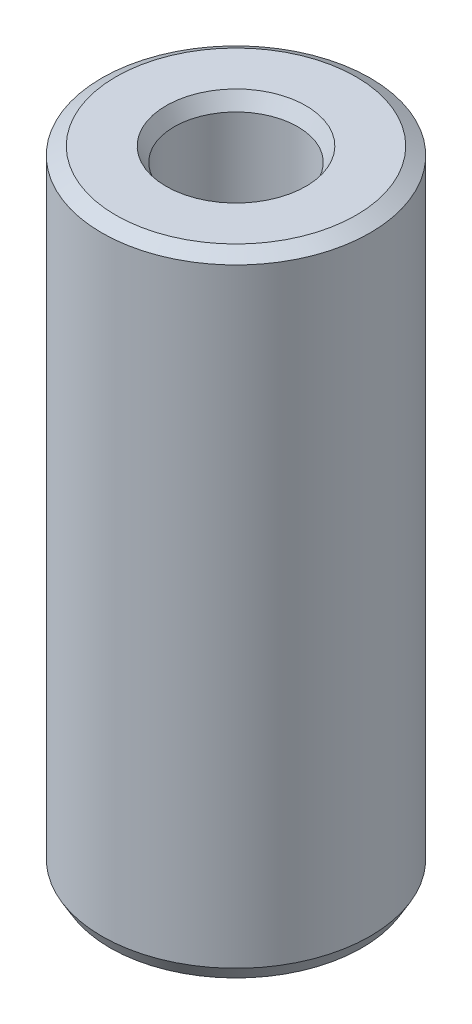
from build123d import *
from OCP.BRepFilletAPI import BRepFilletAPI_MakeChamfer

# Parameters (mm, degrees)
SKETCH1_R           = 40
BOSS_EXTRUDE1_DEPTH = 188.235904036
SKETCH2_R           = 18.406566758
CUT_EXTRUDE1_DEPTH  = 197.552170093
CHAMFER1_SIZE       = 2.434884551
CHAMFER1_SIZE2      = 4.217343752


with BuildPart() as part:
    # Sketch1 → Boss-Extrude1 (new body)
    with BuildSketch(Plane(origin=(0, 0, 0), x_dir=(1, 0, 0), z_dir=(0, 1, 0))):
        Circle(SKETCH1_R)
    extrude(amount=BOSS_EXTRUDE1_DEPTH)

    # Sketch2 → Cut-Extrude1 (cut, through all)
    with BuildSketch(Plane(origin=(0, 0, 0), x_dir=(1, 0, 0), z_dir=(0, 1, 0))):
        Circle(SKETCH2_R)
    extrude(amount=CUT_EXTRUDE1_DEPTH, mode=Mode.SUBTRACT)

    # Chamfer1: one chamfer whose edges measure the first distance from different faces: ONE call of the kernel's chamfer builder (chamfer() names one face for all edges)
    chamfer1_edges_1 = [part.edges().sort_by_distance(p)[0] for p in [
        (-18.406566758, 188.235904036, 0),
    ]]
    chamfer1_side_1 = [part.faces().sort_by_distance(p)[0] for p in [
        (-38.86862915, 188.235904036, 0),
    ]]
    chamfer1_edges_2 = [part.edges().sort_by_distance(p)[0] for p in [
        (-18.406566758, 0, 0),
    ]]
    chamfer1_side_2 = [part.faces().sort_by_distance(p)[0] for p in [
        (-18.406566758, 94.117952018, 0),
    ]]
    chamfer1_edges_3 = [part.edges().sort_by_distance(p)[0] for p in [
        (-40, 0, 0),
    ]]
    chamfer1_side_3 = [part.faces().sort_by_distance(p)[0] for p in [
        (-38.86862915, 0, 0),
    ]]
    chamfer1_edges_4 = [part.edges().sort_by_distance(p)[0] for p in [
        (-40, 188.235904036, 0),
    ]]
    chamfer1_side_4 = [part.faces().sort_by_distance(p)[0] for p in [
        (-40, 94.117952018, 0),
    ]]
    chamfer1 = BRepFilletAPI_MakeChamfer(part.part.solid().wrapped)
    for e in chamfer1_edges_1:
        chamfer1.Add(CHAMFER1_SIZE, CHAMFER1_SIZE2, e.wrapped, chamfer1_side_1[0].wrapped)  # the first distance lies on this face
    for e in chamfer1_edges_2:
        chamfer1.Add(CHAMFER1_SIZE, CHAMFER1_SIZE2, e.wrapped, chamfer1_side_2[0].wrapped)  # the first distance lies on this face
    for e in chamfer1_edges_3:
        chamfer1.Add(CHAMFER1_SIZE, CHAMFER1_SIZE2, e.wrapped, chamfer1_side_3[0].wrapped)  # the first distance lies on this face
    for e in chamfer1_edges_4:
        chamfer1.Add(CHAMFER1_SIZE, CHAMFER1_SIZE2, e.wrapped, chamfer1_side_4[0].wrapped)  # the first distance lies on this face
    add(Compound.cast(chamfer1.Shape()), mode=Mode.REPLACE)


solid = part.part
